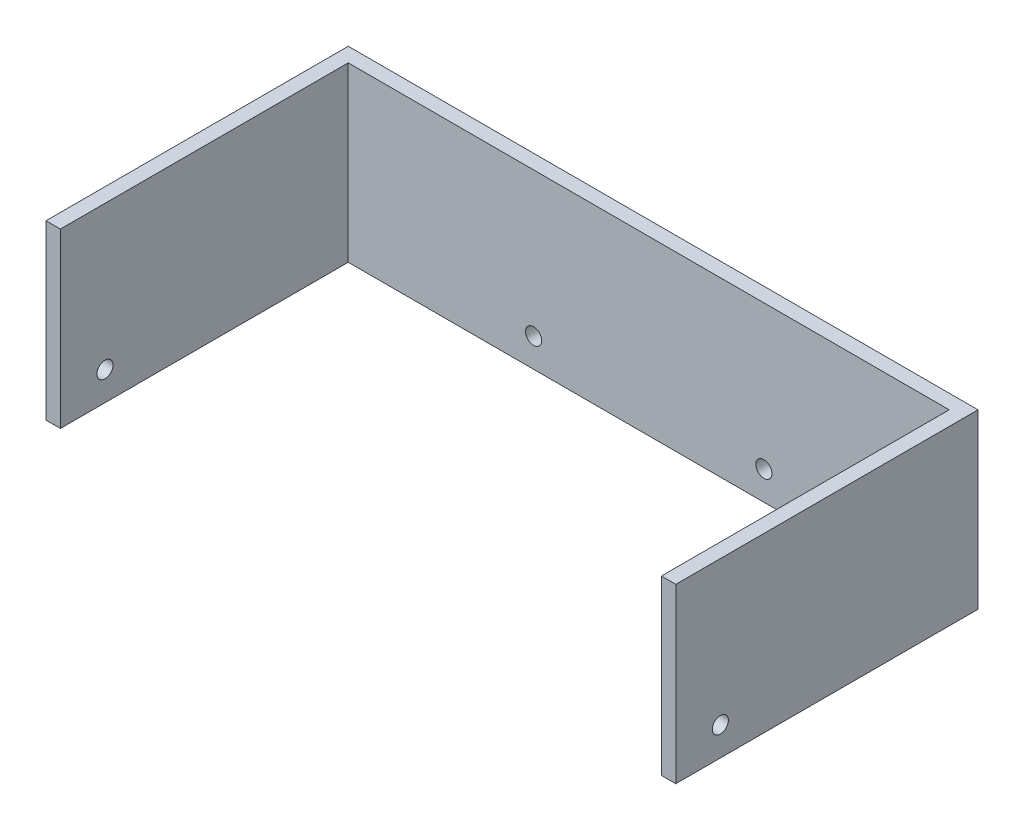
from build123d import *

# Parameters (mm, degrees)
SKETCH1_W           = 138.92560988
SKETCH1_H           = 12.7
SKETCH1_R           = 1.778
BOSS_EXTRUDE1_DEPTH = 3.175
SKETCH2_W           = 3.175
SKETCH2_H           = 12.7
BOSS_EXTRUDE2_DEPTH = 63.5
SKETCH3_R           = 1.778
CUT_EXTRUDE1_DEPTH  = 152.4
BOSS_EXTRUDE3_DEPTH = 25.4


with BuildPart() as part:
    # Sketch1 → Boss-Extrude1 (new body)
    with BuildSketch(Plane.XY):
        with Locations((-69.46280494, -6.35)):
            Rectangle(SKETCH1_W, SKETCH1_H)
        with Locations((-94.86280494, -6.35)):
            Circle(SKETCH1_R, mode=Mode.SUBTRACT)
        with Locations((-44.06280494, -6.35)):
            Circle(SKETCH1_R, mode=Mode.SUBTRACT)
    extrude(amount=BOSS_EXTRUDE1_DEPTH)

    # Sketch2 → Boss-Extrude2 (add)
    with BuildSketch(Plane.XY.offset(3.175)):
        with Locations((-137.33810988, -6.35)):
            Rectangle(SKETCH2_W, SKETCH2_H)
        with Locations((-1.5875, -6.35)):
            Rectangle(SKETCH2_W, SKETCH2_H)
    extrude(amount=BOSS_EXTRUDE2_DEPTH)

    # Sketch3 → Cut-Extrude1 (cut)
    with BuildSketch(Plane(origin=(0, 0, 0), x_dir=(0, 0, -1), z_dir=(1, 0, 0))):
        with Locations((-56.840236332, -6.35)):
            Circle(SKETCH3_R)
    extrude(amount=-CUT_EXTRUDE1_DEPTH, mode=Mode.SUBTRACT)

    # Sketch4 → Boss-Extrude3 (add)
    with BuildSketch(Plane(origin=(0, 0, 0), x_dir=(1, 0, 0), z_dir=(0, 1, 0))):
        Polygon((-135.75060988, -66.675), (-138.92560988, -66.675), (-138.92560988, 0), (0, 0), (0, -66.675), (-3.175, -66.675), (-3.175, -3.175), (-135.75060988, -3.175), align=None)
    extrude(amount=BOSS_EXTRUDE3_DEPTH)


solid = part.part
